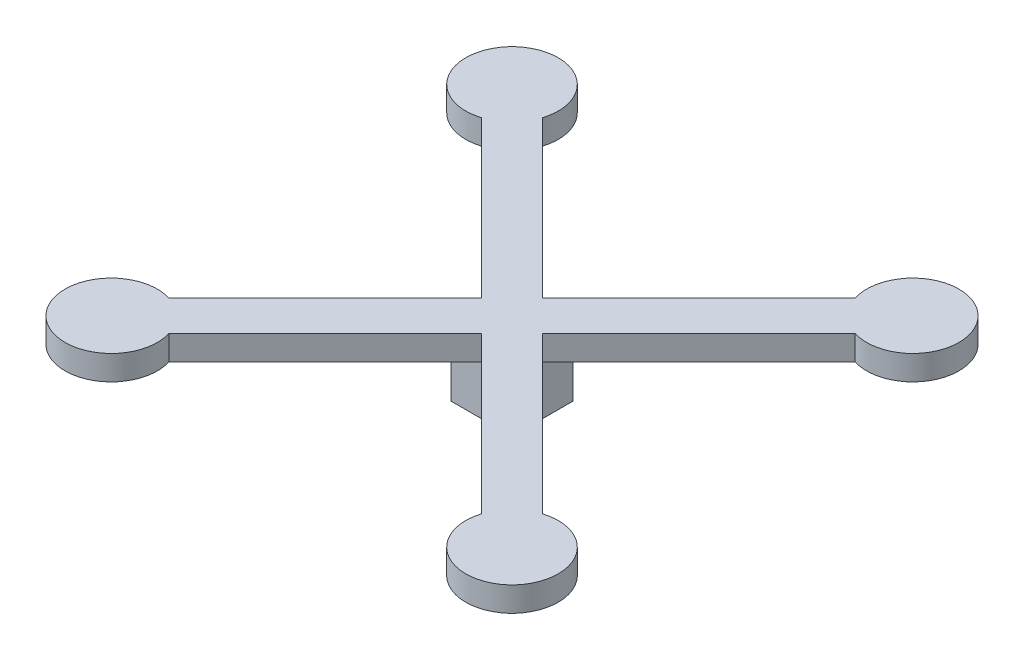
from build123d import *

# Parameters (mm, degrees)
BOSS_EXTRUDE1_DEPTH = 20
SKETCH2_W           = 49.497474684
SKETCH2_H           = 49.497474684
BOSS_EXTRUDE2_DEPTH = 40


with BuildPart() as part:
    # Sketch1 → Boss-Extrude1 (new body)
    with BuildSketch(Plane(origin=(0, 0, 0), x_dir=(1, 0, 0), z_dir=(0, 1, 0))):
        with BuildLine():
            Line((-151.556849545, 126.808112203), (-24.748737342, 0))
            Line((-24.748737342, 0), (-151.556849545, -126.808112203))
            ThreePointArc((-151.556849545, -126.808112203), (-189.151063967, -189.151063967), (-126.808112203, -151.556849545))
            Line((-126.808112203, -151.556849545), (0, -24.748737342))
            Line((0, -24.748737342), (126.808112203, -151.556849545))
            ThreePointArc((126.808112203, -151.556849545), (189.151063967, -189.151063967), (151.556849545, -126.808112203))
            Line((151.556849545, -126.808112203), (24.748737342, 0))
            Line((24.748737342, 0), (151.556849545, 126.808112203))
            ThreePointArc((151.556849545, 126.808112203), (189.151063967, 189.151063967), (126.808112203, 151.556849545))
            Line((126.808112203, 151.556849545), (0, 24.748737342))
            Line((0, 24.748737342), (-126.808112203, 151.556849545))
            ThreePointArc((-126.808112203, 151.556849545), (-189.151063967, 189.151063967), (-151.556849545, 126.808112203))
        make_face()
    extrude(amount=BOSS_EXTRUDE1_DEPTH)

    # Sketch2 → Boss-Extrude2 (add)
    with BuildSketch(Plane.XZ):
        Rectangle(SKETCH2_W, SKETCH2_H)
    extrude(amount=BOSS_EXTRUDE2_DEPTH)


solid = part.part
